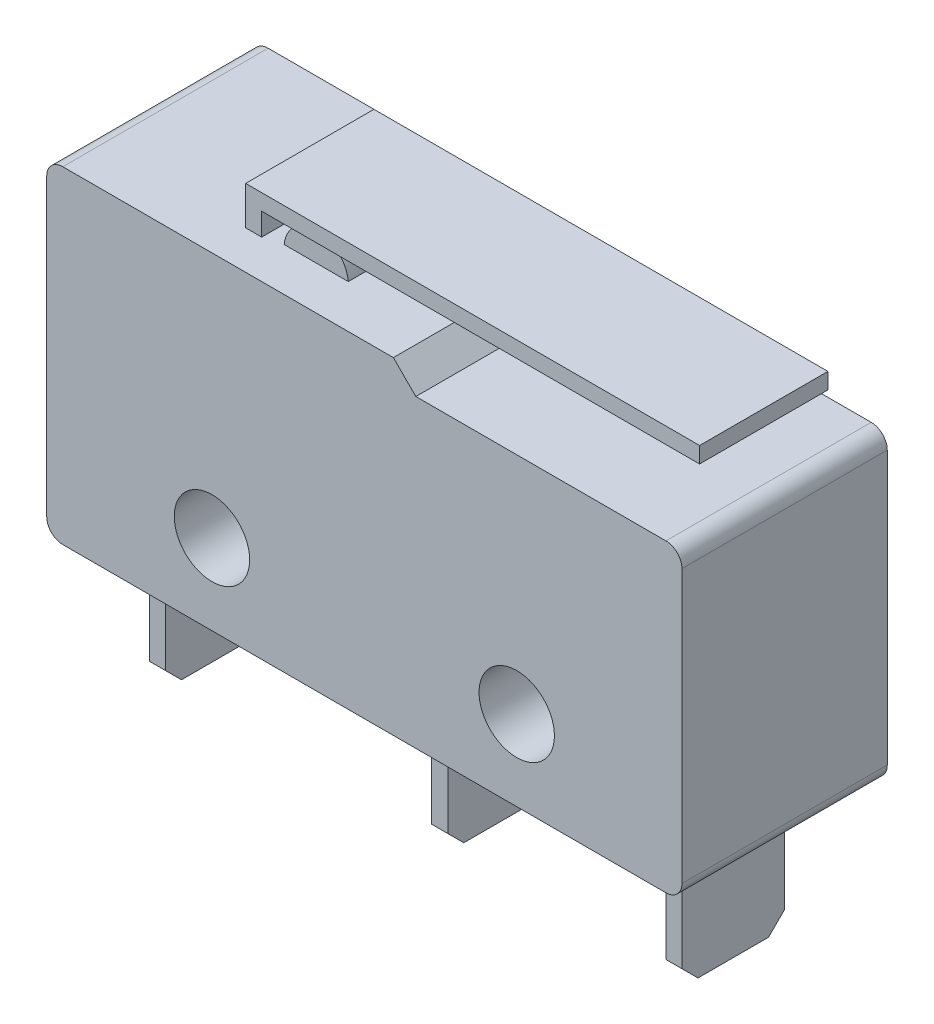
from build123d import *

# Parameters (mm, degrees)
SKETCH_1_W               = 19.8
SKETCH_1_H               = 10.2
EXTRUDE_1_DEPTH          = 6.4
CUT_EXTRUDE_1_DEPTH      = 13.844454056
CUT_EXTRUDE_1_DEPTH_BACK = 13.844454056
SKETCH_3_R               = 1.175
CUT_EXTRUDE_2_DEPTH      = 13.844454056
SKETCH_4_W               = 2
SKETCH_4_H               = 3.7
EXTRUDE_2_DEPTH          = 0.9
FILLET_2_R               = 0.5
FILLET_3_R               = 1
SKETCH_6_W               = 0.5
SKETCH_6_H               = 3.2
EXTRUDE_3_DEPTH          = 3.9
CHAMFER_1_SIZE           = 0.5
EXTRUDE_4_DEPTH          = 2


with BuildPart() as part:
    # 草图1 → 凸台-拉伸1 (new body)
    with BuildSketch(Plane.XY):
        Rectangle(SKETCH_1_W, SKETCH_1_H)
    extrude(amount=EXTRUDE_1_DEPTH)

    # 草图2 → 切除-拉伸1 (cut, two sides: drawn at the far end of the back side and taken through both)
    with BuildSketch(Plane.XY.offset(6.4).offset(-CUT_EXTRUDE_1_DEPTH_BACK)):
        Polygon((9.9, 5.1), (0.905266145, 5.1), (1.605266145, 4.4), (9.9, 4.4), align=None)
    extrude(amount=CUT_EXTRUDE_1_DEPTH + CUT_EXTRUDE_1_DEPTH_BACK, mode=Mode.SUBTRACT)

    # 草图3 → 切除-拉伸2 (cut, through all)
    with BuildSketch(Plane.XY.offset(6.4)):
        with Locations((-4.75, -2.6)):
            Circle(SKETCH_3_R)
        with Locations((4.75, -2.6)):
            Circle(SKETCH_3_R)
    extrude(amount=-CUT_EXTRUDE_2_DEPTH, mode=Mode.SUBTRACT)

    # 草图4 → 凸台-拉伸2 (add)
    with BuildSketch(Plane(origin=(0, 5.1, 0), x_dir=(1, 0, 0), z_dir=(0, 1, 0))):
        with Locations((-2.85, -3.2)):
            Rectangle(SKETCH_4_W, SKETCH_4_H)
    extrude(amount=EXTRUDE_2_DEPTH)

    # 圆角2
    fillet_2_edges = [part.edges().sort_by_distance(p)[0] for p in [
        (9.9, 4.4, 3.2),
        (-9.9, 5.1, 3.2),
        (9.9, -5.1, 3.2),
        (-9.9, -5.1, 3.2),
    ]]
    fillet(fillet_2_edges, radius=FILLET_2_R)

    # 圆角3
    # the kernel refuses this fillet: 1 mm, written as the material it takes off along each edge
    with BuildSketch(Plane(origin=(-1.85, 6, -1.137468593), x_dir=(0, -1, 0), z_dir=(0, 0, 1)), Plane(origin=(-3.85, 6, 7.537468593), x_dir=(0, -1, 0), z_dir=(0, 0, -1))) as fillet_3_piece_1:
        with BuildLine():
            CenterArc((1, -0.994987437), FILLET_3_R, 95.739170477, 84.260829523)
            Line((0, -0.994987437), (-0.02, -0.994987437))
            Line((-0.02, -0.994987437), (-0.02, 0))
            Line((-0.02, 0), (0, 0.02))
            ThreePointArc((0, 0.02), (0.45, 0.02), (0.898, 0.019899749))
            Line((0.898, 0.019899749), (0.9, 0))
        make_face()
    extrude(amount=8.674937186, mode=Mode.SUBTRACT)

    # 草图6 → 凸台-拉伸3 (add)
    with BuildSketch(Plane.XZ.offset(5.1)):
        with Locations((-8.05, 3.2)):
            Rectangle(SKETCH_6_W, SKETCH_6_H)
        with Locations((0.75, 3.2)):
            Rectangle(SKETCH_6_W, SKETCH_6_H)
        with Locations((8.05, 3.2)):
            Rectangle(SKETCH_6_W, SKETCH_6_H)
    extrude(amount=EXTRUDE_3_DEPTH)

    # 倒角1
    chamfer_1_edges = [part.edges().sort_by_distance(p)[0] for p in [
        (0.75, -9, 4.8),
        (0.75, -9, 1.6),
        (8.05, -9, 4.8),
        (8.05, -9, 1.6),
        (-8.05, -9, 4.8),
        (-8.05, -9, 1.6),
    ]]
    chamfer(chamfer_1_edges, length=CHAMFER_1_SIZE)

    # 草图7 → 凸台-拉伸4 (add, symmetric)
    with BuildSketch(Plane(origin=(0, 0, 3.2), x_dir=(-1, 0, 0), z_dir=(0, 0, -1))):
        Polygon((4.9, 5.1), (4.9, 6.3), (-9.25, 6.3), (-9.25, 5.8), (4.4, 5.8), (4.4, 5.1), align=None)
    extrude(amount=EXTRUDE_4_DEPTH, both=True)


solid = part.part
